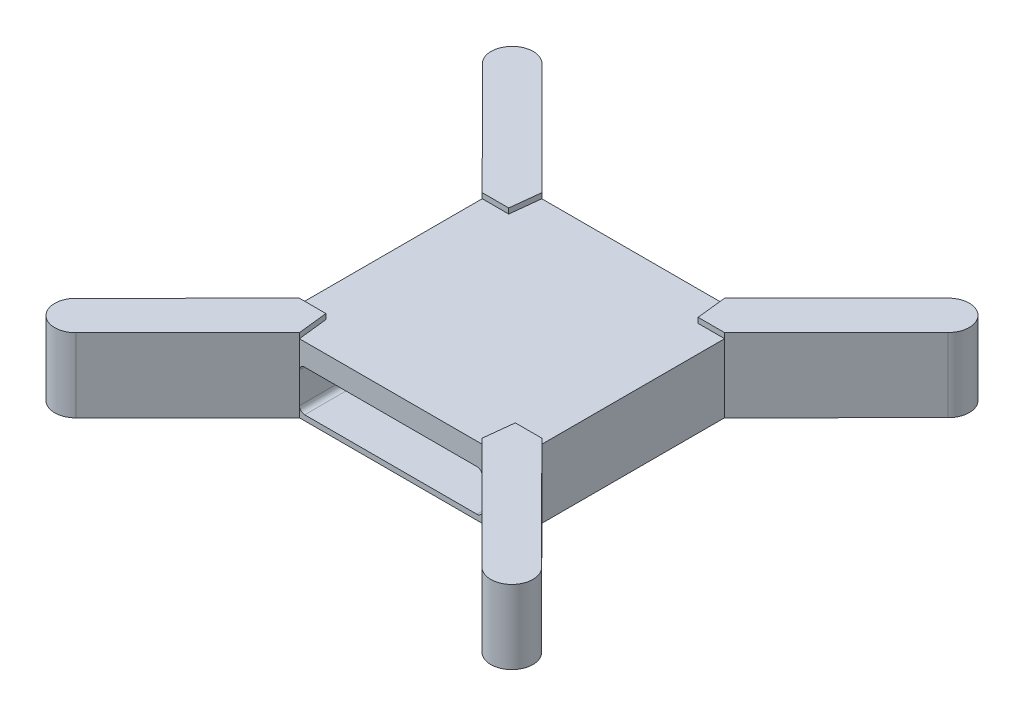
from build123d import *

# Parameters (mm, degrees)
SKETCH1_W           = 46
SKETCH1_H           = 46
BOSS_EXTRUDE1_DEPTH = 13
CUT_EXTRUDE2_DEPTH  = 10
BOSS_EXTRUDE2_START = -13
BOSS_EXTRUDE2_DEPTH = 14
CUT_EXTRUDE4_DEPTH  = 63


# Read off the part's stored shape, not the designer's step: Boss-Extrude2
with BuildPart() as part:
    # Sketch1 → Boss-Extrude1 (new body)
    with BuildSketch(Plane(origin=(0, 0, 0), x_dir=(1, 0, 0), z_dir=(0, 1, 0))):
        Rectangle(SKETCH1_W, SKETCH1_H)
    extrude(amount=BOSS_EXTRUDE1_DEPTH)

    # Sketch2 → Cut-Extrude2 (cut)
    with BuildSketch(Plane(origin=(0, 13, 0), x_dir=(1, 0, 0), z_dir=(0, 1, 0))):
        Polygon((17.339375574, 23), (17.969631493, 17.346908404), (23, 17.346908404), (23, 23), align=None)
        Polygon((-23, 23), (-17.339375574, 23), (-17.969631493, 17.346908404), (-23, 17.346908404), align=None)
        Polygon((-23, -17.346908404), (-23, -23), (-17.339375574, -23), (-17.969631493, -17.346908404), align=None)
        Polygon((17.339375574, -23), (23, -23), (23, -17.346908404), (17.969631493, -17.346908404), align=None)
    extrude(amount=-CUT_EXTRUDE2_DEPTH, mode=Mode.SUBTRACT)

    # Boss-Extrude2 outline → Boss-Extrude2 (add)
    with BuildSketch(Plane(origin=(0, 13, 0), x_dir=(1, 0, 0), z_dir=(0, 1, 0)).offset(BOSS_EXTRUDE2_START)):
        with BuildLine():
            Line((-38.538452146, -44.227320898), (-17.339375574, -23))
            Line((-17.339375574, -23), (-17.969631493, -17.346908404))
            Line((-17.969631493, -17.346908404), (-23, -17.346908404))
            Line((-23, -17.346908404), (-44.202839223, -38.577999476))
            ThreePointArc((-44.202839223, -38.577999476), (-44.195306563, -44.234853893), (-38.538452146, -44.227320898))
        make_face()
        with BuildLine():
            Line((-17.969631493, 17.346908404), (-17.339375574, 23))
            Line((-17.339375574, 23), (-38.538452146, 44.227320898))
            ThreePointArc((-38.538452146, 44.227320898), (-44.195306563, 44.234853893), (-44.202839223, 38.577999476))
            Line((-44.202839223, 38.577999476), (-23, 17.346908404))
            Line((-23, 17.346908404), (-17.969631493, 17.346908404))
        make_face()
        with BuildLine():
            Line((44.202839223, -38.577999476), (23, -17.346908404))
            Line((23, -17.346908404), (17.969631493, -17.346908404))
            Line((17.969631493, -17.346908404), (17.339375574, -23))
            Line((17.339375574, -23), (38.538452146, -44.227320898))
            ThreePointArc((38.538452146, -44.227320898), (44.195306563, -44.234853893), (44.202839223, -38.577999476))
        make_face()
        with BuildLine():
            Line((17.969631493, 17.346908404), (23, 17.346908404))
            Line((23, 17.346908404), (44.202839223, 38.577999476))
            ThreePointArc((44.202839223, 38.577999476), (44.195306563, 44.234853893), (38.538452146, 44.227320898))
            Line((38.538452146, 44.227320898), (17.339375574, 23))
            Line((17.339375574, 23), (17.969631493, 17.346908404))
        make_face()
    extrude(amount=BOSS_EXTRUDE2_DEPTH)

    # Sketch5 → Cut-Extrude4 (cut)
    with BuildSketch(Plane.XY.offset(23)):
        with BuildLine():
            Line((-16.339375574, 1), (16.339375574, 1))
            ThreePointArc((16.339375574, 1), (17.046482355, 1.292893219), (17.339375574, 2))
            Line((17.339375574, 2), (17.339375574, 7.824688375))
            ThreePointArc((17.339375574, 7.824688375), (17.046482355, 8.531795157), (16.339375574, 8.824688375))
            Line((16.339375574, 8.824688375), (-16.339375574, 8.824688375))
            ThreePointArc((-16.339375574, 8.824688375), (-17.046482355, 8.531795157), (-17.339375574, 7.824688375))
            Line((-17.339375574, 7.824688375), (-17.339375574, 2))
            ThreePointArc((-17.339375574, 2), (-17.046482355, 1.292893219), (-16.339375574, 1))
        make_face()
    extrude(amount=-CUT_EXTRUDE4_DEPTH, mode=Mode.SUBTRACT)


solid = part.part
